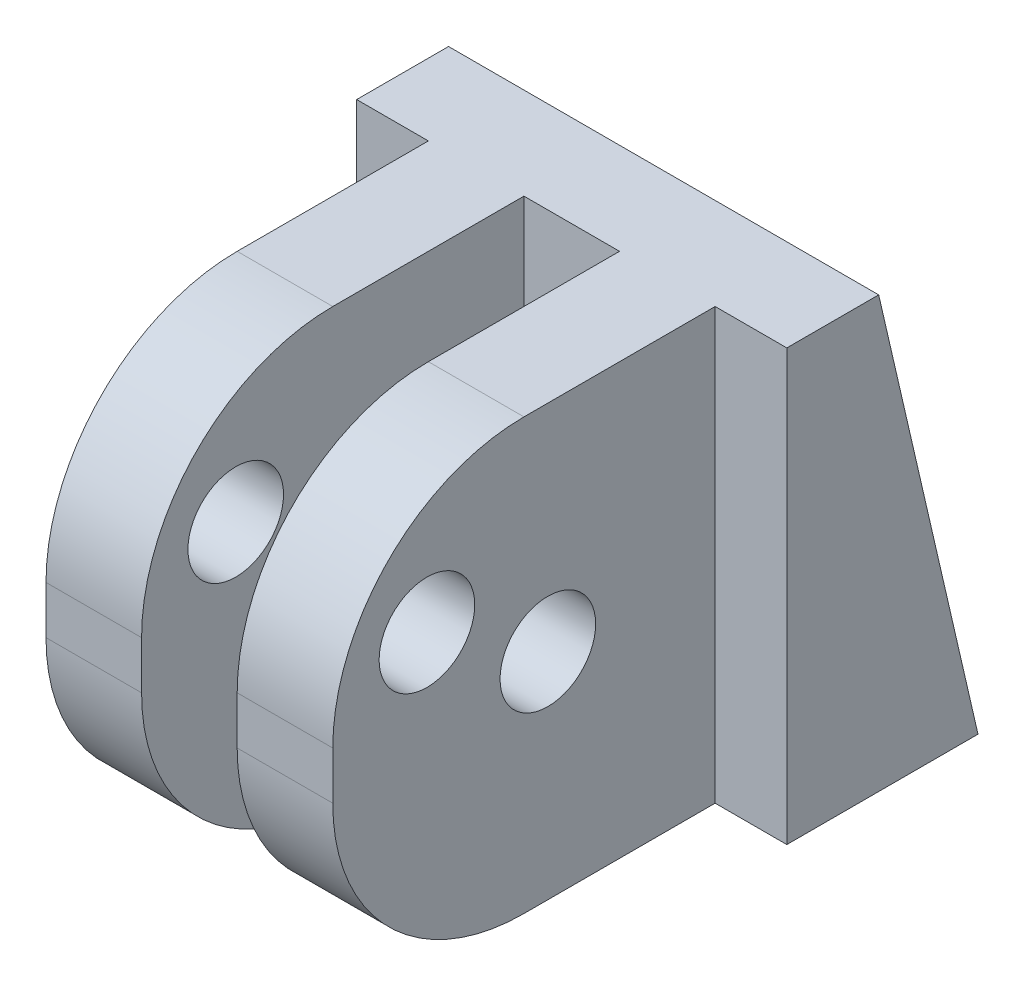
from build123d import *
from build123d.topology import SkipClean

# Parameters (mm, degrees)
SKETCH1_W               = 45
SKETCH1_H               = 45
BOSS_EXTRUDE1_DEPTH     = 20
SKETCH2_W               = 10
SKETCH2_H               = 45
BOSS_EXTRUDE2_DEPTH     = 40
FILLET1_R               = 20
CUT_EXTRUDE3_DEPTH      = 88.464278423
CUT_EXTRUDE4_DEPTH      = 84.852549156
CUT_EXTRUDE4_DEPTH_BACK = 84.852549156
SKETCH4_R               = 5
CUT_EXTRUDE5_REACH      = 89.464
SKETCH5_R               = 5
THREAD2_PITCH           = 1.5
THREAD3_PITCH           = 1.5


with BuildPart() as part:
    # Sketch1 → Boss-Extrude1 (new body)
    with BuildSketch(Plane.XY):
        with Locations((22.5, 22.5)):
            Rectangle(SKETCH1_W, SKETCH1_H)
    extrude(amount=BOSS_EXTRUDE1_DEPTH)

    # Sketch2 → Boss-Extrude2 (add)
    with BuildSketch(Plane.XY.offset(20)):
        with Locations((12.5, 22.5)):
            Rectangle(SKETCH2_W, SKETCH2_H)
        with Locations((32.5, 22.5)):
            Rectangle(SKETCH2_W, SKETCH2_H)
    extrude(amount=BOSS_EXTRUDE2_DEPTH)

    # Fillet1
    fillet1_edges = [part.edges().sort_by_distance(p)[0] for p in [
        (12.5, 0, 60),
        (12.5, 45, 60),
        (32.5, 0, 60),
        (32.5, 45, 60),
    ]]
    fillet(fillet1_edges, radius=FILLET1_R)

    # Sketch3 → Cut-Extrude3 (cut, through all)
    with BuildSketch(Plane(origin=(0, 0, 0), x_dir=(0, 0, -1), z_dir=(1, 0, 0))):
        Polygon((0, 0), (-10.389068601, 45), (0, 45), align=None)
    extrude(amount=CUT_EXTRUDE3_DEPTH, mode=Mode.SUBTRACT)

    # Sketch4 → Cut-Extrude4 (cut, two sides: drawn at the far end of the back side and taken through both)
    with BuildSketch(Plane(origin=(37.5, 0, 0), x_dir=(0, 0, -1), z_dir=(1, 0, 0)).offset(-CUT_EXTRUDE4_DEPTH_BACK)):
        with Locations(Location((-50.150871687, 30.559494125, 0), (0, 0, 90))):
            Circle(SKETCH4_R)
        with Locations(Location((-37.5, 22.5, 0), (0, 0, 90))):
            Circle(SKETCH4_R)
    extrude(amount=CUT_EXTRUDE4_DEPTH + CUT_EXTRUDE4_DEPTH_BACK, mode=Mode.SUBTRACT)

    # Cut-Extrude5: up to this plane
    cut_extrude5_end = Plane(origin=(0, 0, 20), z_dir=(0, 0, -1))
    # Sketch5 → Cut-Extrude5 (cut, up to the surface)
    with BuildSketch(Plane(origin=(0, 0, 0), x_dir=(-1, 0, 0), z_dir=(0, 0.2249510543438588, -0.9743700647852367)), mode=Mode.PRIVATE) as cut_extrude5_sk1:
        with Locations(Location((-22.5, 16.183684851, 0), (0, 0, 90))):
            Circle(SKETCH5_R)
    cut_extrude5_tool1 = split(extrude(cut_extrude5_sk1.sketch, amount=-CUT_EXTRUDE5_REACH, mode=Mode.PRIVATE), bisect_by=cut_extrude5_end, keep=Keep.BOTH, mode=Mode.PRIVATE)
    add(cut_extrude5_tool1.solids().sort_by_distance((22.5, 15.768898, 3.640537))[0], mode=Mode.SUBTRACT)
    # Sketch5 → Cut-Extrude5 (cut, up to the surface)
    with BuildSketch(Plane(origin=(0, 0, 0), x_dir=(-1, 0, 0), z_dir=(0, 0.2249510543438588, -0.9743700647852367)), mode=Mode.PRIVATE) as cut_extrude5_sk2:
        with Locations(Location((-22.5, 36.183684851, 0), (0, 0, 90))):
            Circle(SKETCH5_R)
    cut_extrude5_tool2 = split(extrude(cut_extrude5_sk2.sketch, amount=-CUT_EXTRUDE5_REACH, mode=Mode.PRIVATE), bisect_by=cut_extrude5_end, keep=Keep.BOTH, mode=Mode.PRIVATE)
    add(cut_extrude5_tool2.solids().sort_by_distance((22.5, 35.256299, 8.139558))[0], mode=Mode.SUBTRACT)

    # Thread2: the profile of Thread Profile4 profile screwed along a right-hand helix of 10 turns, 8 arcs to a turn; built about Z, then put on its axis
    thread2_z = Axis((0, 0, 0), (0, 0, 1))
    thread2_corners = [(5.0003, 1e-09, -0.000173205), (5.0003, 0, 1.312673201), (4.188101187, 0, 0.843749998), (4.188101187, 0, 0.468749998)]
    with BuildLine(mode=Mode.PRIVATE) as thread2_profile:
        Line(thread2_corners[0], thread2_corners[1])
        Line(thread2_corners[1], thread2_corners[2])
        Line(thread2_corners[2], thread2_corners[3])
        Line(thread2_corners[3], thread2_corners[0])
    thread2_cap = Face(thread2_profile.wire())
    thread2_turn_angles = [0, 22.5, 45, 67.5, 90, 112.5, 135, 157.5, 180, 202.5, 225, 247.5, 270, 292.5, 315, 337.5, 360]
    thread2_turn_weights = [1, 0.9238795325112867, 1, 0.9238795325112867, 1, 0.9238795325112867, 1, 0.9238795325112867, 1, 0.9238795325112867, 1, 0.9238795325112867, 1, 0.9238795325112867, 1, 0.9238795325112867, 1]
    thread2_turn_rails = [Edge.make_bspline([Vector(p[0], p[1], 0).rotate(thread2_z, thread2_turn_angles[k]) / thread2_turn_weights[k] + Vector(0, 0, p[2] + THREAD2_PITCH * thread2_turn_angles[k] / 360) for k in range(17)], [0, 0, 0, 1, 1, 2, 2, 3, 3, 4, 4, 5, 5, 6, 6, 7, 7, 8, 8, 8], 2, thread2_turn_weights) for p in thread2_corners]
    thread2_turn_sides = [Face.make_surface_from_curves(thread2_turn_rails[p[0]], thread2_turn_rails[p[1]]) for p in [(0, 1), (1, 2), (2, 3), (3, 0)]]
    thread2 = Plane(origin=(22.5, 15.768898056, 3.64053697), x_dir=(1, 0, 0), z_dir=(0, -0.224951054, 0.974370065)) * Solid(Shell([*[p.moved(Location((0, 0, THREAD2_PITCH * i))) for i in range(10) for p in thread2_turn_sides], thread2_cap, thread2_cap.rotate(thread2_z, 3600).moved(Location((0, 0, THREAD2_PITCH * 3600 / 360)))]))
    add(thread2)

    # Thread3: the profile of Thread Profile5 profile screwed along a right-hand helix of 6.666667 turns, 8 arcs to a turn; built about Z, then put on its axis
    with SkipClean():  # the faces are left unmerged after this step: merging them gives an invalid solid
        thread3_z = Axis((0, 0, 0), (0, 0, 1))
        thread3_corners = [(5.0003, 0, -0.000173205), (5.0003, 0, 1.312673201), (4.188101187, 0, 0.843749998), (4.188101187, 0, 0.468749998)]
        with BuildLine(mode=Mode.PRIVATE) as thread3_profile:
            Line(thread3_corners[0], thread3_corners[1])
            Line(thread3_corners[1], thread3_corners[2])
            Line(thread3_corners[2], thread3_corners[3])
            Line(thread3_corners[3], thread3_corners[0])
        thread3_cap = Face(thread3_profile.wire())
        thread3_turn_angles = [0, 22.5, 45, 67.5, 90, 112.5, 135, 157.5, 180, 202.5, 225, 247.5, 270, 292.5, 315, 337.5, 360]
        thread3_turn_weights = [1, 0.9238795325112867, 1, 0.9238795325112867, 1, 0.9238795325112867, 1, 0.9238795325112867, 1, 0.9238795325112867, 1, 0.9238795325112867, 1, 0.9238795325112867, 1, 0.9238795325112867, 1]
        thread3_turn_rails = [Edge.make_bspline([Vector(p[0], p[1], 0).rotate(thread3_z, thread3_turn_angles[k]) / thread3_turn_weights[k] + Vector(0, 0, p[2] + THREAD3_PITCH * thread3_turn_angles[k] / 360) for k in range(17)], [0, 0, 0, 1, 1, 2, 2, 3, 3, 4, 4, 5, 5, 6, 6, 7, 7, 8, 8, 8], 2, thread3_turn_weights) for p in thread3_corners]
        thread3_turn_sides = [Face.make_surface_from_curves(thread3_turn_rails[p[0]], thread3_turn_rails[p[1]]) for p in [(0, 1), (1, 2), (2, 3), (3, 0)]]
        thread3_last_angles = [2160, 2182.5, 2205, 2227.5, 2250, 2272.5, 2295, 2317.5, 2340, 2362.5, 2385, 2392.5, 2400]
        thread3_last_weights = [1, 0.9238795325112867, 1, 0.9238795325112867, 1, 0.9238795325112867, 1, 0.9238795325112867, 1, 0.9238795325112867, 1, 0.9914448613738109, 1]
        thread3_last_rails = [Edge.make_bspline([Vector(p[0], p[1], 0).rotate(thread3_z, thread3_last_angles[k]) / thread3_last_weights[k] + Vector(0, 0, p[2] + THREAD3_PITCH * thread3_last_angles[k] / 360) for k in range(13)], [0, 0, 0, 1, 1, 2, 2, 3, 3, 4, 4, 5, 5, 6, 6, 6], 2, thread3_last_weights) for p in thread3_corners]
        thread3_last_sides = [Face.make_surface_from_curves(thread3_last_rails[p[0]], thread3_last_rails[p[1]]) for p in [(0, 1), (1, 2), (2, 3), (3, 0)]]
        thread3 = Plane(origin=(22.5, 35.256299352, 8.139558057), x_dir=(1, 0, 0), z_dir=(0, -0.224951054, 0.974370065)) * Solid(Shell([*[p.moved(Location((0, 0, THREAD3_PITCH * i))) for i in range(6) for p in thread3_turn_sides], *thread3_last_sides, thread3_cap, thread3_cap.rotate(thread3_z, 2400).moved(Location((0, 0, THREAD3_PITCH * 2400 / 360)))]))
        add(thread3)


solid = part.part
